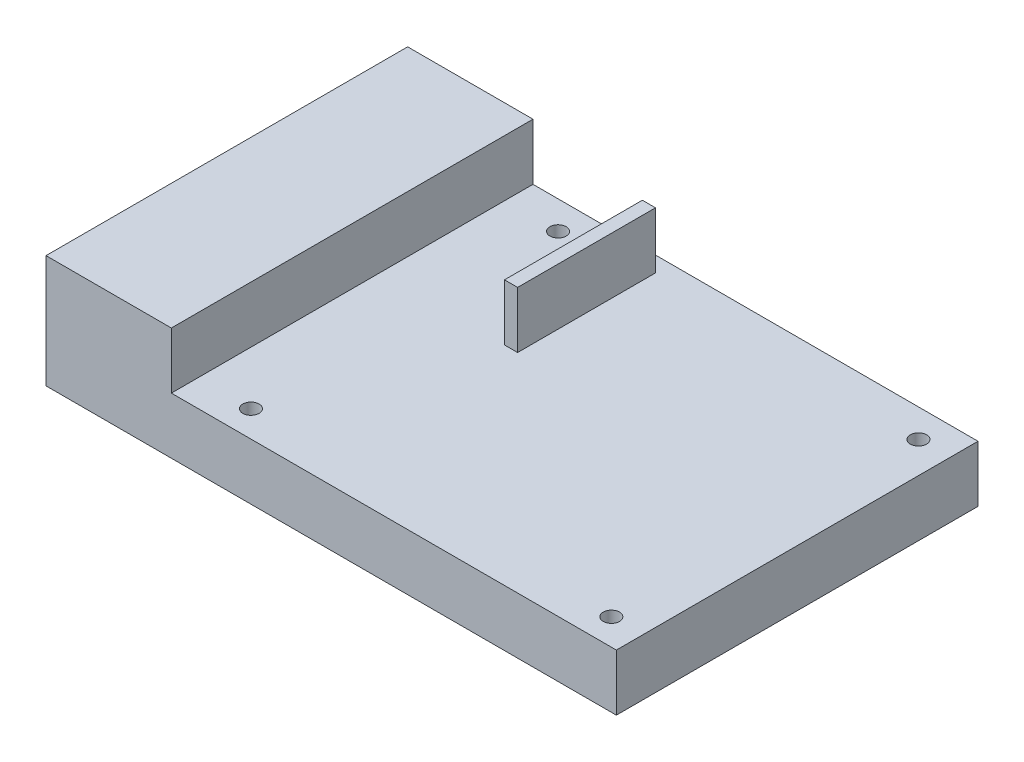
from build123d import *

# Parameters (mm, degrees)
SKETCH1_W             = 20
SKETCH1_H             = 57.7
BOSS_EXTRUDE1_DEPTH   = 18
SKETCH1_W_2           = 2.09336208
SKETCH1_H_2           = 22
BOSS_EXTRUDE1_2_DEPTH = 18
SKETCH1_3_W           = 71
SKETCH1_3_H           = 57.7
SKETCH1_3_R           = 1.3
SKETCH1_3_W_2         = 2.09336208
SKETCH1_3_H_2         = 22
BOSS_EXTRUDE2_DEPTH   = 9


with BuildPart() as part:
    # Sketch1 → Boss-Extrude1 (new body)
    with BuildSketch(Plane(origin=(0, 0, 0), x_dir=(1, 0, 0), z_dir=(0, 1, 0))):
        with Locations((10, -28.85)):
            Rectangle(SKETCH1_W, SKETCH1_H)
    extrude(amount=BOSS_EXTRUDE1_DEPTH)



with BuildPart() as body_2:
    # Sketch1 → Boss-Extrude1 2 (new body)
    with BuildSketch(Plane(origin=(0, 0, 0), x_dir=(1, 0, 0), z_dir=(0, 1, 0))):
        with Locations((40.96668104, -13.469488465)):
            Rectangle(SKETCH1_W_2, SKETCH1_H_2)
    extrude(amount=BOSS_EXTRUDE1_2_DEPTH)


with BuildPart() as part_1:
    add(part.part)

    add(body_2.part)  # Boss-Extrude2 merges body 2
    # Sketch1<3> → Boss-Extrude2 (add)
    with BuildSketch(Plane(origin=(0, 0, 0), x_dir=(1, 0, 0), z_dir=(0, 1, 0))):
        with Locations((55.5, -28.85)):
            Rectangle(SKETCH1_3_W, SKETCH1_3_H)
        with Locations((28.5, -53.5)):
            Circle(SKETCH1_3_R, mode=Mode.SUBTRACT)
        with Locations((86, -53.5)):
            Circle(SKETCH1_3_R, mode=Mode.SUBTRACT)
        with Locations((40.96668104, -13.469488465)):
            Rectangle(SKETCH1_3_W_2, SKETCH1_3_H_2, mode=Mode.SUBTRACT)
        with Locations((28.5, -4.5)):
            Circle(SKETCH1_3_R, mode=Mode.SUBTRACT)
        with Locations((86, -4.5)):
            Circle(SKETCH1_3_R, mode=Mode.SUBTRACT)
    extrude(amount=BOSS_EXTRUDE2_DEPTH)


solid = part_1.part
